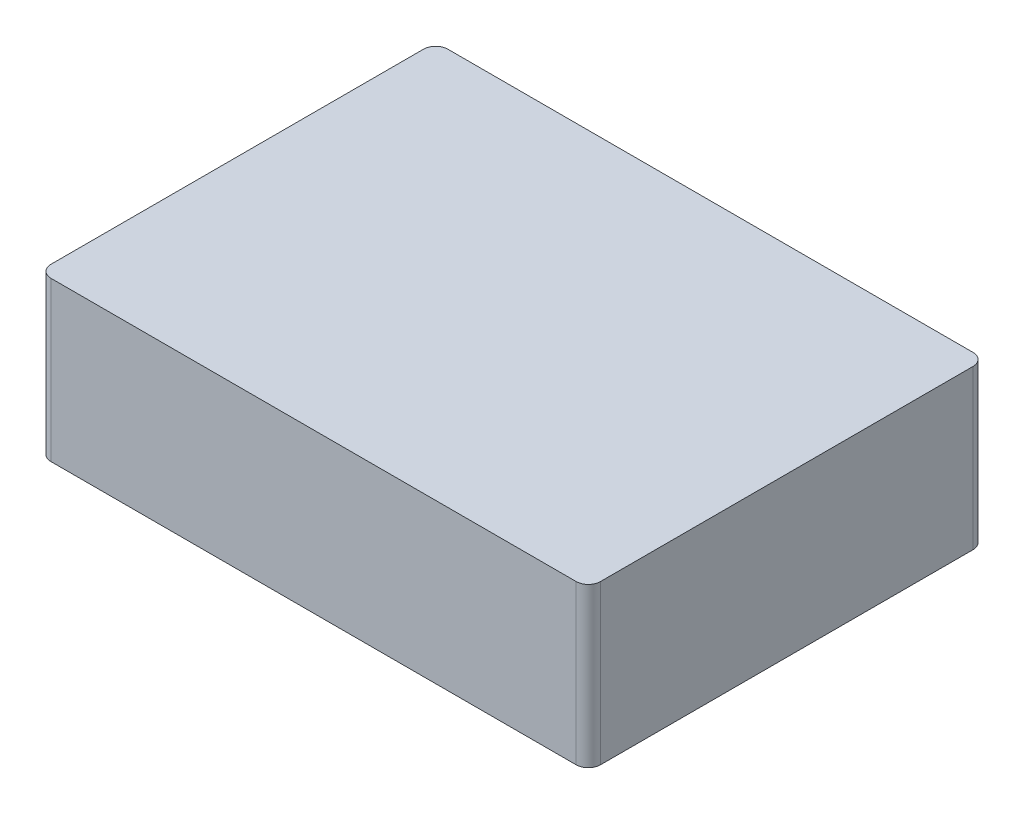
from build123d import *

# Parameters (mm, degrees)
SKETCH1_W           = 90
SKETCH1_H           = 65
BOSS_EXTRUDE1_DEPTH = 26
FILLET1_R           = 2


with BuildPart() as part:
    # Sketch1 → Boss-Extrude1 (new body)
    with BuildSketch(Plane(origin=(0, 0, 0), x_dir=(1, 0, 0), z_dir=(0, 1, 0))):
        Rectangle(SKETCH1_W, SKETCH1_H)
    extrude(amount=BOSS_EXTRUDE1_DEPTH)

    # Fillet1
    fillet1_edges = [part.edges().sort_by_distance(p)[0] for p in [
        (-45, 13, 32.5),
        (-45, 13, -32.5),
        (45, 13, -32.5),
        (45, 13, 32.5),
    ]]
    fillet(fillet1_edges, radius=FILLET1_R)


solid = part.part
